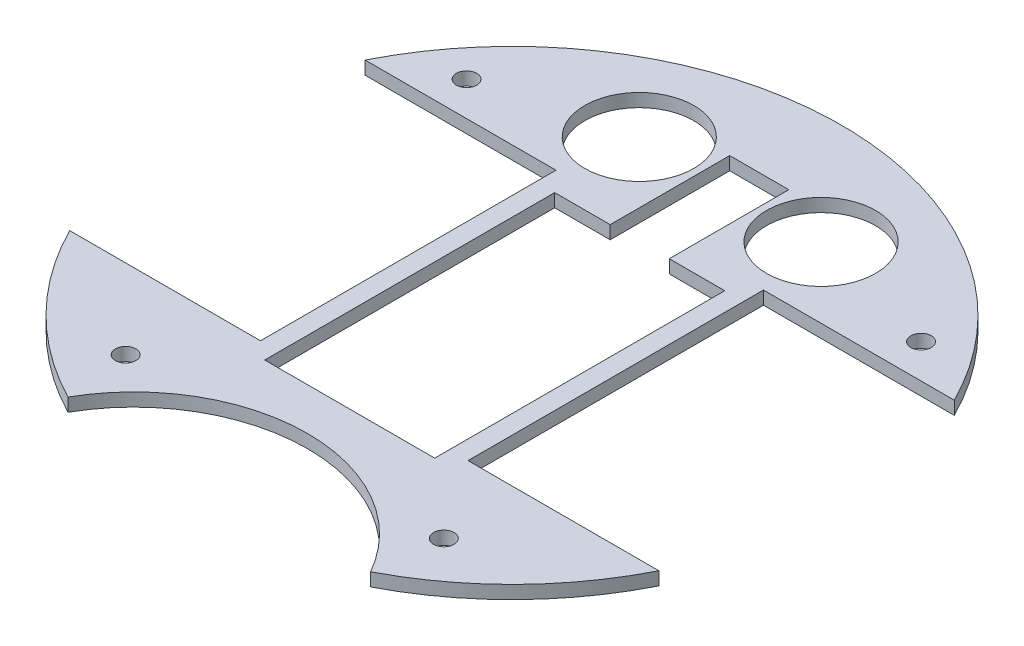
from build123d import *

# Parameters (mm, degrees)
BOSS_EXTRUDE1_DEPTH  = 2.9
SOLENOID_PLACEMENT_W = 37.4
SOLENOID_PLACEMENT_H = 63.8
CUT_EXTRUDE1_DEPTH   = 103.571487266
CUT_EXTRUDE3_DEPTH   = 103.571487266
SKETCH4_W            = 13
SKETCH4_H            = 26.3
CUT_EXTRUDE4_DEPTH   = 98.286484159
SKETCH5_R            = 12
CUT_EXTRUDE5_DEPTH   = 98.286484159
SKETCH6_R            = 2.25
CUT_EXTRUDE6_DEPTH   = 98.286484159


with BuildPart() as part:
    # Sketch1 → Boss-Extrude1 (new body)
    with BuildSketch(Plane(origin=(0, 0, 0), x_dir=(1, 0, 0), z_dir=(0, 1, 0))):
        with BuildLine():
            ThreePointArc((33.29110537, -64.404598464), (0, 72.5), (-33.29110537, -64.404598464))
            ThreePointArc((-33.29110537, -64.404598464), (0, -44.989799638), (33.29110537, -64.404598464))
        make_face()
    extrude(amount=BOSS_EXTRUDE1_DEPTH)

    # solenoid placement → Cut-Extrude1 (cut, through all)
    with BuildSketch(Plane(origin=(0, 2.9, 0), x_dir=(1, 0, 0), z_dir=(0, 1, 0))):
        with Locations((0, -3.8)):
            Rectangle(SOLENOID_PLACEMENT_W, SOLENOID_PLACEMENT_H)
    extrude(amount=-CUT_EXTRUDE1_DEPTH, mode=Mode.SUBTRACT)

    # Sketch3 → Cut-Extrude3 (cut, through all)
    with BuildSketch(Plane(origin=(0, 2.9, 0), x_dir=(1, 0, 0), z_dir=(0, 1, 0))):
        with BuildLine():
            Line((-34.63, -32.5), (-22.83, -32.5))
            Line((-22.83, -32.5), (-22.83, 32.5))
            Line((-22.83, 32.5), (-64.807406984, 32.5))
            ThreePointArc((-64.807406984, 32.5), (-72.5, 0), (-64.807406984, -32.5))
            Line((-64.807406984, -32.5), (-34.63, -32.5))
        make_face()
        with BuildLine():
            Line((34.63, -32.5), (64.807406984, -32.5))
            ThreePointArc((64.807406984, -32.5), (72.5, 0), (64.807406984, 32.5))
            Line((64.807406984, 32.5), (22.83, 32.5))
            Line((22.83, 32.5), (22.83, -32.5))
            Line((22.83, -32.5), (34.63, -32.5))
        make_face()
    extrude(amount=-CUT_EXTRUDE3_DEPTH, mode=Mode.SUBTRACT)

    # Sketch4 → Cut-Extrude4 (cut, through all)
    with BuildSketch(Plane(origin=(0, 2.9, 0), x_dir=(1, 0, 0), z_dir=(0, 1, 0))):
        with Locations((0, 41.25)):
            Rectangle(SKETCH4_W, SKETCH4_H)
    extrude(amount=-CUT_EXTRUDE4_DEPTH, mode=Mode.SUBTRACT)

    # Sketch5 → Cut-Extrude5 (cut, through all)
    with BuildSketch(Plane(origin=(0, 2.9, 0), x_dir=(1, 0, 0), z_dir=(0, 1, 0))):
        with Locations((-20, 48)):
            Circle(SKETCH5_R)
        with Locations((20, 48)):
            Circle(SKETCH5_R)
    extrude(amount=-CUT_EXTRUDE5_DEPTH, mode=Mode.SUBTRACT)

    # Sketch6 → Cut-Extrude6 (cut, through all)
    with BuildSketch(Plane(origin=(0, 2.9, 0), x_dir=(1, 0, 0), z_dir=(0, 1, 0))):
        with Locations((35, -50)):
            Circle(SKETCH6_R)
        with Locations((-35, -50)):
            Circle(SKETCH6_R)
        with Locations((-50, 40)):
            Circle(SKETCH6_R)
        with Locations((50, 40)):
            Circle(SKETCH6_R)
    extrude(amount=-CUT_EXTRUDE6_DEPTH, mode=Mode.SUBTRACT)


solid = part.part
